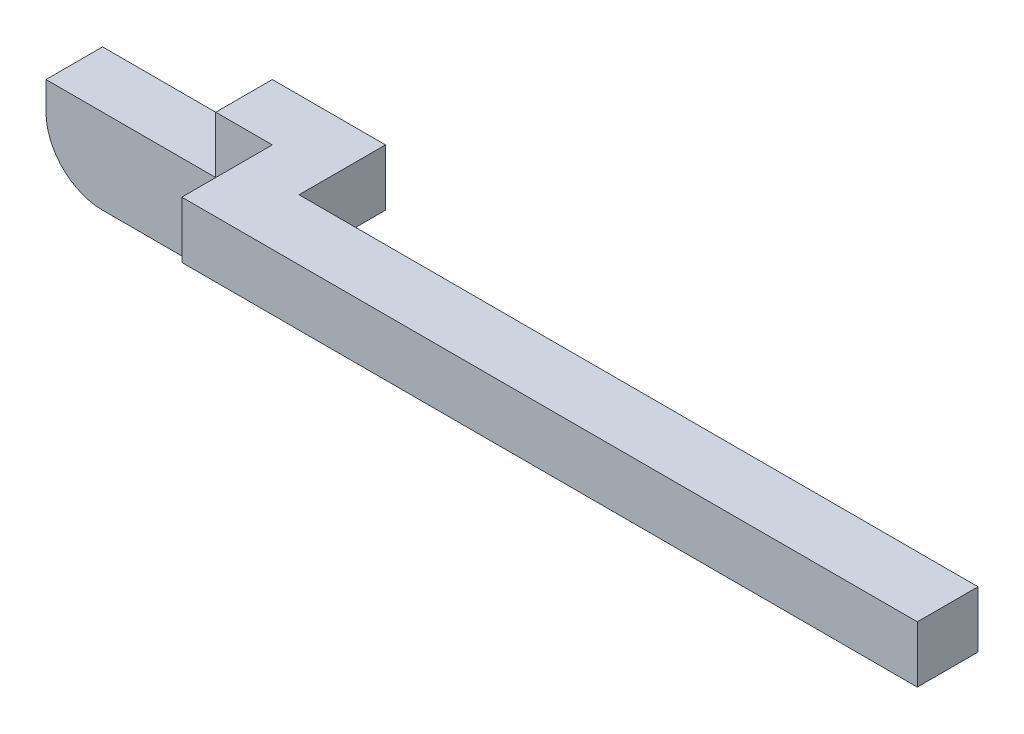
from build123d import *

# Parameters (mm, degrees)
SKETCH1_W           = 431.8
SKETCH1_H           = 63.5
BOSS_EXTRUDE1_DEPTH = 25.4
SKETCH2_W           = 330.2
SKETCH2_H           = 38.1
CUT_EXTRUDE1_DEPTH  = 334.35988061
SKETCH3_W           = 330.2
SKETCH3_H           = 25.4
BOSS_EXTRUDE2_DEPTH = 40.64
SKETCH4_W           = 76.2
SKETCH4_H           = 25.4
CUT_EXTRUDE2_DEPTH  = 335.866032317
SKETCH5_W           = 327.36600593
SKETCH5_H           = 53.343711601
CUT_EXTRUDE3_DEPTH  = 343.674147843
HOLE1_D             = 12.7
HOLE1_DEPTH         = 5.08
FILLET1_R           = 25.4
FILLET2_R           = 25.4


with BuildPart() as part:
    # Sketch1 → Boss-Extrude1 (new body)
    with BuildSketch(Plane.XY.offset(25.4)):
        with Locations((114.3, -6.35)):
            Rectangle(SKETCH1_W, SKETCH1_H)
    extrude(amount=-BOSS_EXTRUDE1_DEPTH)

    # Sketch2 → Cut-Extrude1 (cut, through all)
    with BuildSketch(Plane(origin=(0, 0, 0), x_dir=(-1, 0, 0), z_dir=(0, 0, -1))):
        with Locations((-165.1, -19.05)):
            Rectangle(SKETCH2_W, SKETCH2_H)
    extrude(amount=-CUT_EXTRUDE1_DEPTH, mode=Mode.SUBTRACT)

    # Sketch3 → Boss-Extrude2 (add)
    with BuildSketch(Plane.XY.offset(25.4)):
        with Locations((165.1, 12.7)):
            Rectangle(SKETCH3_W, SKETCH3_H)
    extrude(amount=BOSS_EXTRUDE2_DEPTH)

    # Sketch4 → Cut-Extrude2 (cut, through all)
    with BuildSketch(Plane.XY.offset(25.4)):
        with Locations((-63.5, 12.7)):
            Rectangle(SKETCH4_W, SKETCH4_H)
    extrude(amount=-CUT_EXTRUDE2_DEPTH, mode=Mode.SUBTRACT)

    # Sketch5 → Cut-Extrude3 (cut, through all)
    with BuildSketch(Plane(origin=(0, 25.4, 0), x_dir=(-1, 0, 0), z_dir=(0, 1, 0))):
        with Locations((-189.083002965, 12.121110399)):
            Rectangle(SKETCH5_W, SKETCH5_H)
    extrude(amount=-CUT_EXTRUDE3_DEPTH, mode=Mode.SUBTRACT)

    # Hole1
    with Locations(Plane(origin=(0, 0, 0), x_dir=(-1, 0, 0), z_dir=(0, 0, -1))):
        with Locations((-12.7, 12.7)):
            Hole(HOLE1_D / 2, depth=HOLE1_DEPTH)

    # Fillet1
    fillet1_edges = [part.edges().sort_by_distance(p)[0] for p in [
        (-101.6, -38.1, 12.7),
    ]]
    fillet(fillet1_edges, radius=FILLET1_R)

    # Fillet2
    fillet2_edges = [part.edges().sort_by_distance(p)[0] for p in [
        (0, -38.1, 12.7),
    ]]
    fillet(fillet2_edges, radius=FILLET2_R)


solid = part.part
